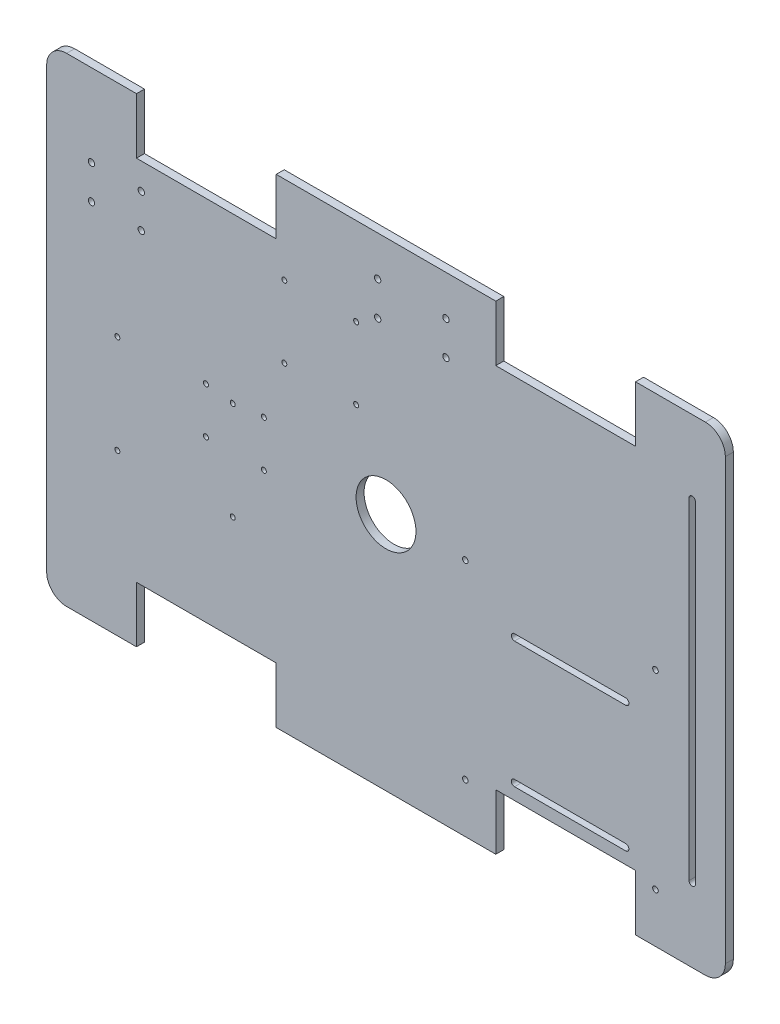
from build123d import *

# Parameters (mm, degrees)
EXTRUDE_1_DEPTH             = 4
SKETCH_1_4_R                = 1.25
CUT_EXTRUDE_4_DEPTH         = 10
PATTERN_LINEAR_1_COUNT      = 2
PATTERN_LINEAR_1_PITCH      = 29
PATTERN_LINEAR_1_COUNT_DIR2 = 2
PATTERN_LINEAR_1_PITCH_DIR2 = 23
CUT_EXTRUDE_6_DEPTH         = 19
SKETCH_1_7_R                = 1.4
CUT_EXTRUDE_8_DEPTH         = 9
SKETCH_1_8_R                = 15
CUT_EXTRUDE_12_DEPTH        = 9
SKETCH_4_R                  = 1.6
SKETCH_4_R_2                = 1.5983
CUT_EXTRUDE_14_DEPTH        = 10
SKETCH_5_W                  = 70
SKETCH_5_H                  = 28
CUT_EXTRUDE_15_DEPTH        = 10
SKETCH_5_3_W                = 70
SKETCH_5_3_H                = 28
CUT_EXTRUDE_16_DEPTH        = 10
CUT_EXTRUDE_17_DEPTH        = 10
SKETCH_8_R                  = 1.250014498
SKETCH_8_R_2                = 1.249970002
SKETCH_8_R_3                = 1.248648169
SKETCH_8_R_4                = 1.246007349
SKETCH_8_R_5                = 1.25
CUT_EXTRUDE_18_DEPTH        = 10


with BuildPart() as part:
    # 草图1 → 凸台-拉伸1 (new body)
    with BuildSketch(Plane.XY):
        with BuildLine():
            Line((160, -120), (-160, -120))
            ThreePointArc((-160, -120), (-167.071067812, -117.071067812), (-170, -110))
            Line((-170, -110), (-170, 110))
            ThreePointArc((-170, 110), (-167.071067812, 117.071067812), (-160, 120))
            Line((-160, 120), (160, 120))
            ThreePointArc((160, 120), (167.071067812, 117.071067812), (170, 110))
            Line((170, 110), (170, -110))
            ThreePointArc((170, -110), (167.071067812, -117.071067812), (160, -120))
        make_face()
    extrude(amount=EXTRUDE_1_DEPTH)

    # 草图1<4> → 切除-拉伸4 (cut)
    with BuildSketch(Plane.XY):
        with Locations((-90.205317251, 11.5)):
            Circle(SKETCH_1_4_R)
    cut_extrude_4 = extrude(amount=CUT_EXTRUDE_4_DEPTH, mode=Mode.SUBTRACT)

    # 阵列(线性)1: Cut-Extrude 4 2 × 2
    with Locations(*[(i * PATTERN_LINEAR_1_PITCH, -j * PATTERN_LINEAR_1_PITCH_DIR2, 0) for i in range(PATTERN_LINEAR_1_COUNT) for j in range(PATTERN_LINEAR_1_COUNT_DIR2) if (i, j) != (0, 0)]):
        add(cut_extrude_4, mode=Mode.SUBTRACT)

    # 草图1<6> → 切除-拉伸6 (cut)
    with BuildSketch(Plane.XY):
        with BuildLine():
            Line((151.8, -83), (151.8, 83))
            ThreePointArc((151.8, 83), (153.4, 84.600001673), (155, 83))
            Line((155, 83), (155, -83))
            ThreePointArc((155, -83), (153.4, -84.600001673), (151.8, -83))
        make_face()
    extrude(amount=CUT_EXTRUDE_6_DEPTH, mode=Mode.SUBTRACT)

    # 草图1<7> → 切除-拉伸8 (cut)
    with BuildSketch(Plane.XY):
        with Locations((135, -95.25)):
            Circle(SKETCH_1_7_R)
        with Locations((39.75, -95.25)):
            Circle(SKETCH_1_7_R)
        with Locations((135, 0)):
            Circle(SKETCH_1_7_R)
        with Locations((39.75, 0)):
            Circle(SKETCH_1_7_R)
    extrude(amount=CUT_EXTRUDE_8_DEPTH, mode=Mode.SUBTRACT)

    # 草图1<8> → 切除-拉伸12 (cut)
    with BuildSketch(Plane.XY):
        Circle(SKETCH_1_8_R)
    extrude(amount=CUT_EXTRUDE_12_DEPTH, mode=Mode.SUBTRACT)

    # 草图4 → 切除-拉伸14 (cut)
    with BuildSketch(Plane(origin=(0, 0, 0), x_dir=(-1, 0, 0), z_dir=(0, 0, -1))):
        with Locations((-30.023523843, 100)):
            Circle(SKETCH_4_R)
        with Locations((4.176472579, 100)):
            Circle(SKETCH_4_R)
        with Locations((4.176472579, 83)):
            Circle(SKETCH_4_R)
        with Locations((-30.023523843, 83)):
            Circle(SKETCH_4_R)
        with Locations((122.593892579, 78.829934953)):
            Circle(SKETCH_4_R_2)
        with Locations((147.556664683, 78.829934953)):
            Circle(SKETCH_4_R_2)
        with Locations((122.593892579, 61.829934953)):
            Circle(SKETCH_4_R_2)
        with Locations((147.556664683, 61.829934953)):
            Circle(SKETCH_4_R_2)
    extrude(amount=-CUT_EXTRUDE_14_DEPTH, mode=Mode.SUBTRACT)

    # 草图5 → 切除-拉伸15 (cut)
    with BuildSketch(Plane.XY.offset(4)):
        with Locations((-90, 106)):
            Rectangle(SKETCH_5_W, SKETCH_5_H)
    extrude(amount=-CUT_EXTRUDE_15_DEPTH, mode=Mode.SUBTRACT)

    # 草图5<3> → 切除-拉伸16 (cut)
    with BuildSketch(Plane.XY.offset(4)):
        with Locations((90, 106)):
            Rectangle(SKETCH_5_3_W, SKETCH_5_3_H)
        with Locations((90, -106)):
            Rectangle(SKETCH_5_3_W, SKETCH_5_3_H)
        with Locations((-90, -106)):
            Rectangle(SKETCH_5_3_W, SKETCH_5_3_H)
    extrude(amount=-CUT_EXTRUDE_16_DEPTH, mode=Mode.SUBTRACT)

    # 草图7 → 切除-拉伸17 (cut)
    with BuildSketch(Plane.XY.offset(4)):
        with BuildLine():
            Line((64.372416064, -82.8), (120.087353981, -82.8))
            ThreePointArc((120.087353981, -82.8), (121.687353981, -84.4), (120.087353981, -86))
            Line((120.087353981, -86), (64.372416064, -86))
            ThreePointArc((64.372416064, -86), (62.772416064, -84.4), (64.372416064, -82.8))
        make_face()
        with BuildLine():
            Line((64.372416064, -22.8), (120.087353981, -22.8))
            ThreePointArc((120.087353981, -22.8), (121.687353981, -21.2), (120.087353981, -19.6))
            Line((120.087353981, -19.6), (64.372416064, -19.6))
            ThreePointArc((64.372416064, -19.6), (62.772416064, -21.2), (64.372416064, -22.8))
        make_face()
    extrude(amount=-CUT_EXTRUDE_17_DEPTH, mode=Mode.SUBTRACT)

    # 草图8 → 切除-拉伸18 (cut)
    with BuildSketch(Plane(origin=(0, 0, 0), x_dir=(-1, 0, 0), z_dir=(0, 0, -1))):
        with Locations((14.957713147, 76.11708776)):
            Circle(SKETCH_8_R)
        with Locations((50.957713147, 76.11708776)):
            Circle(SKETCH_8_R_2)
        with Locations((50.957713147, 40.11708776)):
            Circle(SKETCH_8_R_3)
        with Locations((14.957713147, 40.11708776)):
            Circle(SKETCH_8_R_4)
        with Locations((134.576524212, -39.567178843)):
            Circle(SKETCH_8_R_5)
        with Locations((134.576524212, 9.732821157)):
            Circle(SKETCH_8_R_5)
        with Locations((76.776524212, 9.732821157)):
            Circle(SKETCH_8_R_5)
        with Locations((76.776524212, -39.567178843)):
            Circle(SKETCH_8_R_5)
    extrude(amount=-CUT_EXTRUDE_18_DEPTH, mode=Mode.SUBTRACT)


solid = part.part
